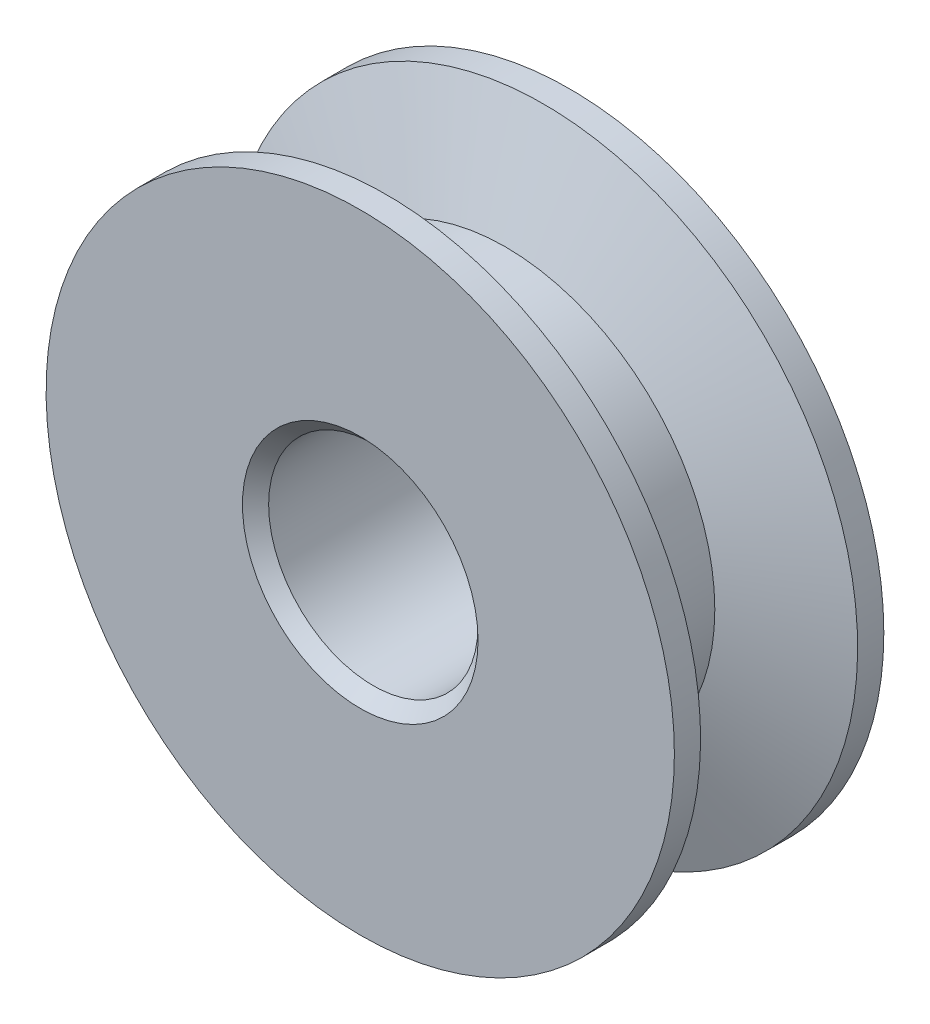
from build123d import *

# Parameters (mm, degrees)
SKETCH1_R      = 19.05
SKETCH1_R_2    = 6.35
EXTRUDE1_DEPTH = 6.35
CHAMFER1_SIZE  = 0.79375


with BuildPart() as part:
    # Sketch1 → Extrude1 (new, symmetric)
    with BuildSketch(Plane.XY):
        Circle(SKETCH1_R)
        Circle(SKETCH1_R_2, mode=Mode.SUBTRACT)
    extrude(amount=EXTRUDE1_DEPTH, both=True)

    # Chamfer1
    chamfer1_edges = [part.edges().sort_by_distance(p)[0] for p in [
        (-6.35, 0, -6.35),
        (-6.35, 0, 6.35),
    ]]
    chamfer(chamfer1_edges, length=CHAMFER1_SIZE)

    # Sketch2 → Cut-Revolve1 (revolve, cut)
    with BuildSketch(Plane(origin=(0, 0, 0), x_dir=(0, 0, -1), z_dir=(1, 0, 0))):
        Polygon((-4.7625, 19.05), (4.7625, 19.05), (2.451289012, 12.7), (-2.451289012, 12.7), align=None)
    revolve(axis=Axis((0, 0, 6.35), (0, 0, -1)), mode=Mode.SUBTRACT)


solid = part.part
